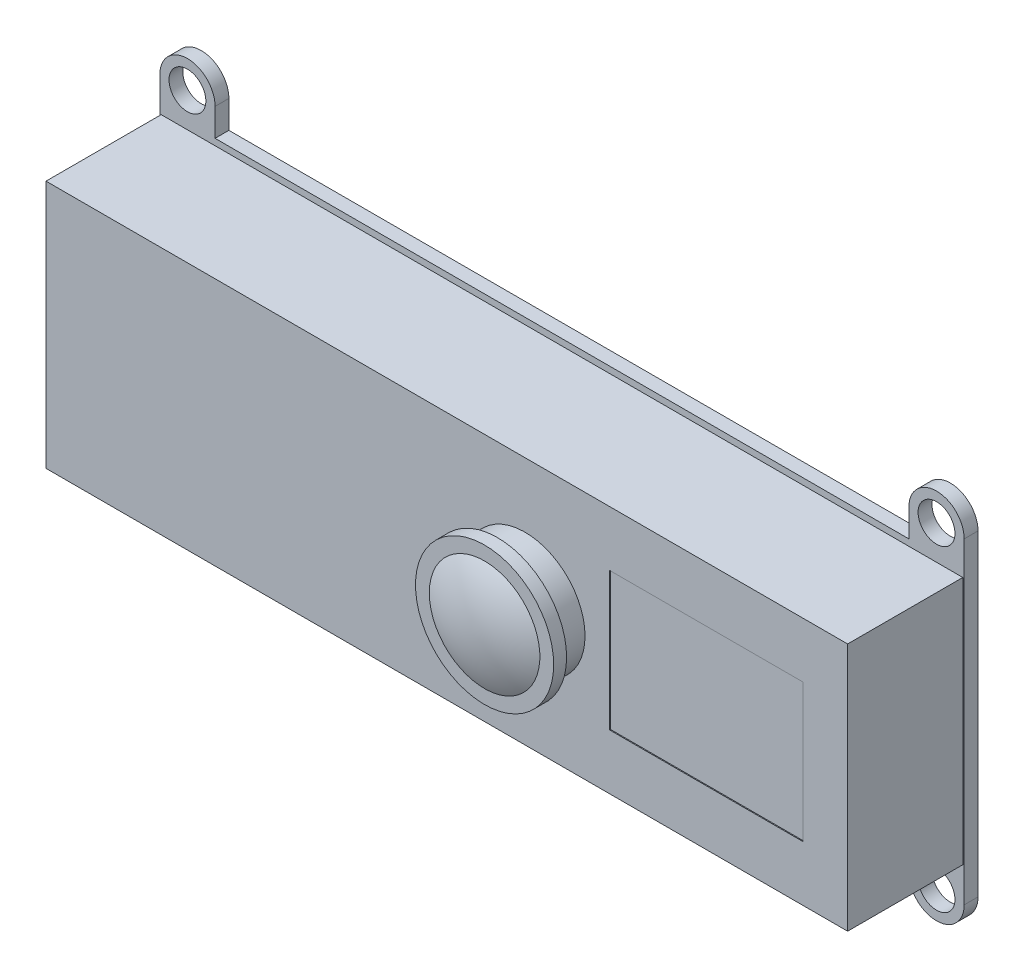
from build123d import *

# Parameters (mm, degrees)
CROQUIS1_W              = 87
CROQUIS1_H              = 27
SALIENTE_EXTRUIR1_DEPTH = 12.5
CROQUIS2_R              = 2
SALIENTE_EXTRUIR3_DEPTH = 1.5
CROQUIS3_R              = 6.5
SALIENTE_EXTRUIR4_DEPTH = 3
CROQUIS4_R              = 7.5
SALIENTE_EXTRUIR5_DEPTH = 1.4
CROQUIS8_W              = 21
CROQUIS8_H              = 15
CORTAR_EXTRUIR2_DEPTH   = 0.1
SALIENTE_EXTRUIR6_DEPTH = 1.7


with BuildPart() as part:
    # Croquis1 → Saliente-Extruir1 (new body)
    with BuildSketch(Plane.XY):
        Rectangle(CROQUIS1_W, CROQUIS1_H)
    extrude(amount=SALIENTE_EXTRUIR1_DEPTH)

    # Croquis2 → Saliente-Extruir3 (add)
    with BuildSketch(Plane(origin=(0, 0, 0), x_dir=(-1, 0, 0), z_dir=(0, 0, -1))):
        with BuildLine():
            Line((43.65, -17.2), (43.65, 17.2))
            ThreePointArc((43.65, 17.2), (40.65, 20.2), (37.65, 17.2))
            Line((37.65, 17.2), (37.65, 14.2))
            Line((37.65, 14.2), (-37.65, 14.2))
            Line((-37.65, 14.2), (-37.65, 17.2))
            ThreePointArc((-37.65, 17.2), (-40.65, 20.2), (-43.65, 17.2))
            Line((-43.65, 17.2), (-43.65, -17.2))
            ThreePointArc((-43.65, -17.2), (-40.65, -20.2), (-37.65, -17.2))
            Line((-37.65, -17.2), (-37.65, -14.2))
            Line((-37.65, -14.2), (37.65, -14.2))
            Line((37.65, -14.2), (37.65, -17.2))
            ThreePointArc((37.65, -17.2), (40.65, -20.2), (43.65, -17.2))
        make_face()
        with Locations((40.65, -17.2)):
            Circle(CROQUIS2_R, mode=Mode.SUBTRACT)
        with Locations((-40.65, -17.2)):
            Circle(CROQUIS2_R, mode=Mode.SUBTRACT)
        with Locations((-40.65, 17.2)):
            Circle(CROQUIS2_R, mode=Mode.SUBTRACT)
        with Locations((40.65, 17.2)):
            Circle(CROQUIS2_R, mode=Mode.SUBTRACT)
    extrude(amount=SALIENTE_EXTRUIR3_DEPTH)

    # Croquis3 → Saliente-Extruir4 (add)
    with BuildSketch(Plane.XY.offset(12.5)):
        with Locations((8.5, 0)):
            Circle(CROQUIS3_R)
    extrude(amount=SALIENTE_EXTRUIR4_DEPTH)

    # Croquis4 → Saliente-Extruir5 (add)
    with BuildSketch(Plane.XY.offset(15.5)):
        with Locations((8.5, 0)):
            Circle(CROQUIS4_R)
    extrude(amount=SALIENTE_EXTRUIR5_DEPTH)

    # Croquis7 → Revolución3 (revolve)
    with BuildSketch(Plane(origin=(0, 0, 0), x_dir=(1, 0, 0), z_dir=(0, 1, 0))):
        with BuildLine():
            Line((14.5, -16.9), (8.5, -16.9))
            Line((8.5, -16.9), (8.5, -18.4))
            ThreePointArc((8.5, -18.4), (11.592329219, -18.019316877), (14.5, -16.9))
        make_face()
    revolve(axis=Axis((8.5, 0, 16.9), (0, 0, 1)))

    # Croquis8 → Cortar-Extruir2 (cut)
    with BuildSketch(Plane.XY.offset(12.5)):
        with Locations((28.15, 0)):
            Rectangle(CROQUIS8_W, CROQUIS8_H)
    extrude(amount=-CORTAR_EXTRUIR2_DEPTH, mode=Mode.SUBTRACT)

    # Croquis9 → Saliente-Extruir6 (add)
    # profile 1 of 2: a face of its own
    with BuildSketch(Plane.ZY.offset(43.5)):
        with BuildLine():
            Line((0, 3.25), (0, -3.25))
            ThreePointArc((0, -3.25), (1.75, -5), (3.5, -3.25))
            Line((3.5, -3.25), (3.5, 3.25))
            ThreePointArc((3.5, 3.25), (1.75, 5), (0, 3.25))
        make_face()
        with BuildLine():
            ThreePointArc((3.2, -3.25), (1.75, -4.7), (0.3, -3.25))
            Line((0.3, -3.25), (0.3, 3.25))
            ThreePointArc((0.3, 3.25), (1.75, 4.7), (3.2, 3.25))
            Line((3.2, 3.25), (3.2, -3.25))
        make_face(mode=Mode.SUBTRACT)
    # profile 2 of 2: a face of its own
    with BuildSketch(Plane.ZY.offset(43.5)):
        with BuildLine():
            Line((1.5, 3.25), (1.5, -3.25))
            ThreePointArc((1.5, -3.25), (1.75, -3.5), (2, -3.25))
            Line((2, -3.25), (2, 3.25))
            ThreePointArc((2, 3.25), (1.75, 3.5), (1.5, 3.25))
        make_face()
    extrude(amount=SALIENTE_EXTRUIR6_DEPTH)


solid = part.part
